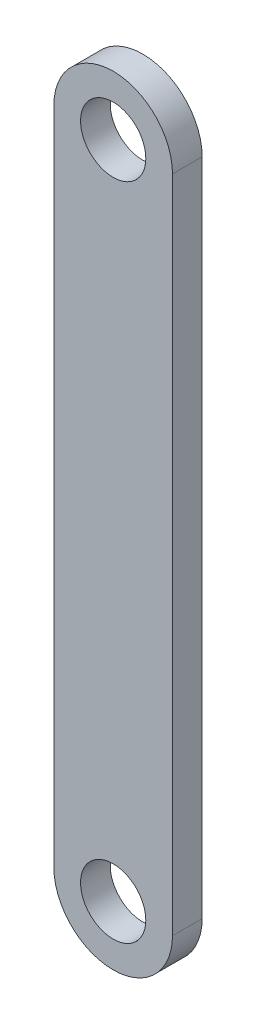
from build123d import *

# Parameters (mm, degrees)
MODEL_R        = 1.1
EXTRUDE1_DEPTH = 1


with BuildPart() as part:
    # Model → Extrude1 (new body)
    with BuildSketch(Plane.XY):
        with BuildLine():
            ThreePointArc((2, 22.2444), (0, 24.2444), (-2, 22.2444))
            Line((-2, 22.2444), (-2, 0))
            ThreePointArc((-2, 0), (0, -2), (2, 0))
            Line((2, 0), (2, 22.2444))
        make_face()
        Circle(MODEL_R, mode=Mode.SUBTRACT)
        with Locations((0, 22.2444)):
            Circle(MODEL_R, mode=Mode.SUBTRACT)
    extrude(amount=EXTRUDE1_DEPTH)


solid = part.part
